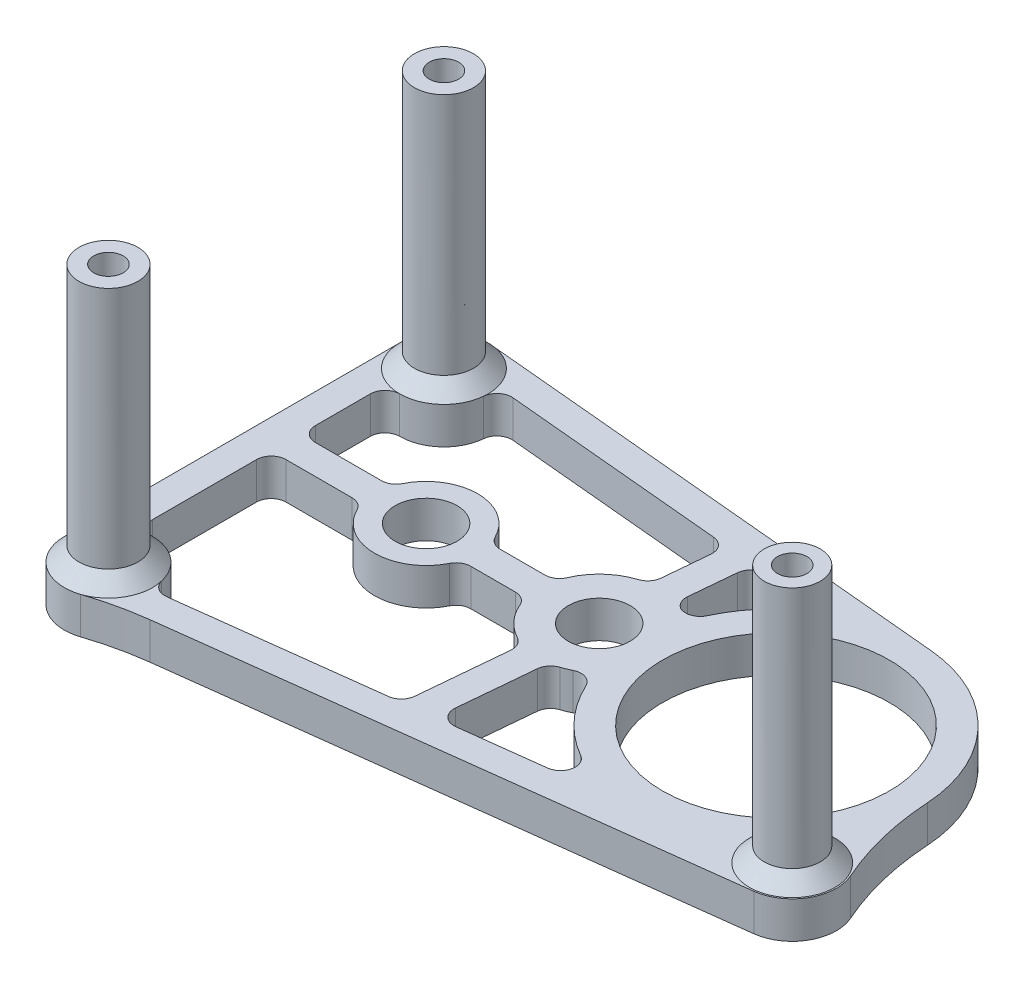
from build123d import *

# Parameters (mm, degrees)
SKETCH2_W           = 97.751871484
SKETCH2_H           = 58.283909604
SKETCH2_R           = 9.779
SKETCH2_R_2         = 2.667
BOSS_EXTRUDE1_DEPTH = 3.175
SKETCH4_R           = 1.27
CUT_EXTRUDE1_DEPTH  = 38.354
BOSS_EXTRUDE2_START = 22.225
SKETCH5_R           = 2.54
SKETCH5_R_2         = 1.27
SKETCH5_R_3         = 2.413
BOSS_EXTRUDE2_DEPTH = 22.225
SKETCH6_W           = 97.751871484
SKETCH6_H           = 58.283909604
CUT_EXTRUDE2_DEPTH  = 25.4
FILLET4_R           = 25.4
CHAMFER1_SIZE       = 1.27
FILLET5_R           = 1.27
FILLET6_R           = 25.4
SKETCH10_R          = 4.445
SKETCH10_R_2        = 2.667
BOSS_EXTRUDE4_DEPTH = 3.175
CUT_EXTRUDE4_DEPTH  = 11.049
FILLET8_R           = 1.27


# Some blends are built 0.0001 mm under size
with BuildPart() as part:
    # Sketch2 → Boss-Extrude1 (new body)
    with BuildSketch(Plane(origin=(0, 0, 0), x_dir=(1, 0, 0), z_dir=(0, 1, 0))):
        with Locations((-16.988515934, 0.541740914)):
            Rectangle(SKETCH2_W, SKETCH2_H)
        with Locations(Location((-4.463227118, 0, 0), (0, 0, 270))):
            Circle(SKETCH2_R, mode=Mode.SUBTRACT)
        with Locations(Location((-19.703227118, 0, 0), (0, 0, 270))):
            Circle(SKETCH2_R_2, mode=Mode.SUBTRACT)
    extrude(amount=BOSS_EXTRUDE1_DEPTH)

    # Sketch4 → Cut-Extrude1 (cut)
    with BuildSketch(Plane(origin=(0, 3.175, 0), x_dir=(1, 0, 0), z_dir=(0, 1, 0))):
        with Locations(Location((6.487419808, -9.550213888, 0), (0, 0, 270))):
            Circle(SKETCH4_R)
        with Locations(Location((-45.435275157, -16.572284597, 0), (0, 0, 270))):
            Circle(SKETCH4_R)
        with Locations(Location((-45.435275157, 12.346724353, 0), (0, 0, 270))):
            Circle(SKETCH4_R)
    extrude(amount=-CUT_EXTRUDE1_DEPTH, mode=Mode.SUBTRACT)

    # Sketch5 → Boss-Extrude2 (add)
    # profile 1 of 3: a face of its own
    with BuildSketch(Plane(origin=(0, 3.175, 0), x_dir=(1, 0, 0), z_dir=(0, 1, 0)).offset(BOSS_EXTRUDE2_START)):
        with Locations(Location((-45.435275157, -16.572284597, 0), (0, 0, 90))):
            Circle(SKETCH5_R)
        with Locations(Location((-45.435275157, -16.572284597, 0), (0, 0, 270))):
            Circle(SKETCH5_R_2, mode=Mode.SUBTRACT)
    # profile 2 of 3: a face of its own
    with BuildSketch(Plane(origin=(0, 3.175, 0), x_dir=(1, 0, 0), z_dir=(0, 1, 0)).offset(BOSS_EXTRUDE2_START)):
        with Locations(Location((6.487419808, -9.550213888, 0), (0, 0, 90))):
            Circle(SKETCH5_R_3)
        with Locations(Location((6.487419808, -9.550213888, 0), (0, 0, 270))):
            Circle(SKETCH5_R_2, mode=Mode.SUBTRACT)
    # profile 3 of 3: a face of its own
    with BuildSketch(Plane(origin=(0, 3.175, 0), x_dir=(1, 0, 0), z_dir=(0, 1, 0)).offset(BOSS_EXTRUDE2_START)):
        with Locations(Location((-45.435275157, 12.346724353, 0), (0, 0, 90))):
            Circle(SKETCH5_R)
        with Locations(Location((-45.435275157, 12.346724353, 0), (0, 0, 270))):
            Circle(SKETCH5_R_2, mode=Mode.SUBTRACT)
    extrude(amount=-BOSS_EXTRUDE2_DEPTH)

    # Sketch6 → Cut-Extrude2 (cut)
    # profile 1 of 5: a face of its own
    with BuildSketch(Plane.XZ):
        with Locations((-16.988515934, -0.541740914)):
            Rectangle(SKETCH6_W, SKETCH6_H)
        with BuildLine():
            ThreePointArc((6.436488339, 5.740554325), (6.365628562, -5.87312912), (-3.329944281, -12.266761227))
            Line((-3.329944281, -12.266761227), (-44.737248056, -16.092236089))
            ThreePointArc((-44.737248056, -16.092236089), (-47.870086931, -15.277217763), (-49.245275157, -12.346724353))
            Line((-49.245275157, -12.346724353), (-49.245275157, 16.572284597))
            ThreePointArc((-49.245275157, 16.572284597), (-47.084422142, 20.006875434), (-43.052931733, 19.545589124))
            Line((-43.052931733, 19.545589124), (6.957251299, 13.331134195))
            ThreePointArc((6.957251299, 13.331134195), (10.28848479, 9.289436202), (6.436488339, 5.740554325))
        make_face(mode=Mode.SUBTRACT)
    # profile 2 of 5: a face of its own
    with BuildSketch(Plane.XZ):
        with BuildLine():
            Line((-22.309779638, 14.408430842), (-41.632671147, 16.809566593))
            ThreePointArc((-41.632671147, 16.809566593), (-43.139721395, 13.531473368), (-46.705275157, 12.980182148))
            Line((-46.705275157, 12.980182148), (-46.705275157, 1.27))
            Line((-46.705275157, 1.27), (-24.752974537, 1.27))
            ThreePointArc((-24.752974537, 1.27), (-23.550764492, 3.508461936), (-21.432391729, 4.911500662))
            Line((-21.432391729, 4.911500662), (-22.309779638, 14.408430842))
        make_face()
    # profile 3 of 5: a face of its own
    with BuildSketch(Plane.XZ):
        with BuildLine():
            ThreePointArc((-18.90316261, 5.145167226), (-17.439844382, 4.689344047), (-16.172627118, 3.827233027))
            ThreePointArc((-16.172627118, 3.827233027), (-12.021521278, 9.727792678), (-5.278151046, 12.292016108))
            Line((-5.278151046, 12.292016108), (-19.729338668, 14.087775465))
            Line((-19.729338668, 14.087775465), (-18.90316261, 5.145167226))
        make_face()
    # profile 4 of 5: a face of its own
    with BuildSketch(Plane.XZ):
        with BuildLine():
            Line((-41.737410786, -13.264274947), (-19.939248877, -11.250419593))
            Line((-19.939248877, -11.250419593), (-20.503291626, -5.145167226))
            ThreePointArc((-20.503291626, -5.145167226), (-23.211689054, -3.847537374), (-24.752974537, -1.27))
            Line((-24.752974537, -1.27), (-46.705275157, -1.27))
            Line((-46.705275157, -1.27), (-46.705275157, -8.754621904))
            ThreePointArc((-46.705275157, -8.754621904), (-42.874440529, -9.525691562), (-41.737410786, -13.264274947))
        make_face()
    # profile 5 of 5: a face of its own
    with BuildSketch(Plane.XZ):
        with BuildLine():
            Line((-17.410019758, -11.016753028), (-11.023764962, -10.426749455))
            ThreePointArc((-11.023764962, -10.426749455), (-14.175902418, -7.577710705), (-16.172627118, -3.827233027))
            ThreePointArc((-16.172627118, -3.827233027), (-17.018047419, -4.461239624), (-17.974062507, -4.911500662))
            Line((-17.974062507, -4.911500662), (-17.410019758, -11.016753028))
        make_face()
    extrude(amount=-CUT_EXTRUDE2_DEPTH, mode=Mode.SUBTRACT)

    # Fillet4
    fillet4_edges = [part.edges().sort_by_distance(p)[0] for p in [
        (6.436488339, 1.5875, 5.740554325),
    ]]
    fillet(fillet4_edges, radius=FILLET4_R)

    # Chamfer1
    chamfer1_edges = [part.edges().sort_by_distance(p)[0] for p in [
        (-45.435275157, 3.175, 19.112284597),
        (6.487419808, 3.175, 11.963213888),
        (-45.435275157, 3.175, -9.806724353),
    ]]
    chamfer(chamfer1_edges, length=CHAMFER1_SIZE - 0.0001)  # a hair under: the kernel refuses the full size

    # Fillet5
    # the kernel refuses this fillet: 1.27 mm, written as the material it adds along each edge
    with BuildSketch(Plane(origin=(-17.974062507, 0, -4.911500662), x_dir=(0.09199471039426901, 0, -0.9957594956913414), z_dir=(0, 1, 0)), Plane(origin=(-24.752974537, 0, -1.27), x_dir=(-1, 0, 0), z_dir=(0, 1, 0))) as fillet5_piece_1:
        with BuildLine():
            CenterArc((0.908434266, -1.27), FILLET5_R, 90, 66.911227563)
            ThreePointArc((-0.259836652, -0.771960784), (-0.114800695, -0.391068882), (0, 0))
            Line((0, 0), (0.908434266, 0))
        make_face()
    extrude(amount=3.175)
    with BuildSketch(Plane(origin=(-16.172627118, 0, -3.827233027), x_dir=(0.3684237494880866, 0, -0.9296579698002592), z_dir=(0, 1, 0))) as fillet5_piece_2:
        with BuildLine():
            CenterArc((1.589945225, 1.267606245), FILLET5_R, 174.6438829, 91.83772784)
            ThreePointArc((0.325490362, 1.38615539), (0.210349349, 0.681899513), (0, 0))
            ThreePointArc((0, 0), (0.756003367, 0.023219427), (1.512006734, 0))
        make_face()
    extrude(amount=3.175)
    with BuildSketch(Plane(origin=(-11.023764962, 0, -10.426749455), x_dir=(-0.7764213228150341, 0, 0.6302141933328324), z_dir=(0, 1, 0))) as fillet5_piece_3:
        with BuildLine():
            CenterArc((3.106991559, -1.260834502), FILLET5_R, 96.887717688, 128.767983471)
            Line((2.219301663, -2.169078218), (0, 0))
            ThreePointArc((0, 0), (1.477344026, -0.08890533), (2.954688051, 0))
        make_face()
    extrude(amount=3.175)
    with BuildSketch(Plane(origin=(-17.410019758, 0, -11.016753028), x_dir=(0.9957594956913395, 0, 0.09199471039428954), z_dir=(0, 1, 0)), Plane(origin=(-46.705275157, 0, -1.27), x_dir=(0, 0, -1), z_dir=(0, 1, 0)), Plane(origin=(-19.939248877, 0, -11.250419593), x_dir=(-0.09199471039428968, 0, 0.9957594956913395), z_dir=(0, 1, 0)), Plane(origin=(-46.705275157, 0, 1.27), x_dir=(1, 0, 0), z_dir=(0, 1, 0))) as fillet5_piece_4:
        with BuildLine():
            CenterArc((FILLET5_R, -FILLET5_R), FILLET5_R, 90, 90)
            Line((0, -FILLET5_R), (0, 0))
            Line((0, 0), (FILLET5_R, 0))
        make_face()
    extrude(amount=3.175)
    with BuildSketch(Plane(origin=(-41.737410786, 0, -13.264274947), x_dir=(0.07388880850314143, 0, 0.9972664859394333), z_dir=(0, 1, 0))) as fillet5_piece_5:
        with BuildLine():
            CenterArc((1.49756055, 1.251850976), FILLET5_R, 170.484249697, 89.817777443)
            Line((0.245035504, 1.461805755), (0, 0))
            ThreePointArc((0, 0), (0.641811664, 0.054447073), (1.283623328, 0))
        make_face()
    extrude(amount=3.175)
    with BuildSketch(Plane(origin=(-46.705275157, 0, -8.754621904), x_dir=(0.9855985596534799, 0, 0.16910197872581528), z_dir=(0, 1, 0))) as fillet5_piece_6:
        with BuildLine():
            CenterArc((1.503316591, -1.251710171), FILLET5_R, 99.735610317, 90)
            Line((0.25160642, -1.466469684), (0, 0))
            ThreePointArc((0, 0), (0.644278539, -0.054869488), (1.288557078, 0))
        make_face()
    extrude(amount=3.175)
    with BuildSketch(Plane(origin=(-20.503291626, 0, -5.145167226), x_dir=(-0.973080394076375, 0, 0.23046593384742647), z_dir=(0, 1, 0)), Plane(origin=(-24.752974537, 0, 1.27), x_dir=(0.31900689110536185, 0, 0.9477523956325786), z_dir=(0, 1, 0)), Plane(origin=(-18.90316261, 0, 5.145167226), x_dir=(0.9730803940763765, 0, -0.23046593384742128), z_dir=(0, 1, 0))) as fillet5_piece_7:
        with BuildLine():
            CenterArc((0.913848751, -1.266109504), FILLET5_R, 94.485895933, 66.911227563)
            Line((-0.289796791, -0.860970752), (0, 0))
            ThreePointArc((0, 0), (0.407258683, -0.015951034), (0.814517365, 0))
        make_face()
    extrude(amount=3.175)
    with BuildSketch(Plane(origin=(-46.705275157, 0, 12.980182148), x_dir=(0, 0, -1), z_dir=(0, 1, 0))) as fillet5_piece_8:
        with BuildLine():
            CenterArc((1.487897552, -1.27), FILLET5_R, 90, 90)
            ThreePointArc((0.217897552, -1.27), (0.163028064, -0.625721461), (0, 0))
            Line((0, 0), (1.487897552, 0))
        make_face()
    extrude(amount=3.175)
    with BuildSketch(Plane(origin=(-41.632671147, 0, 16.809566593), x_dir=(-0.08633378250672864, 0, -0.9962662686240465), z_dir=(0, 1, 0))) as fillet5_piece_9:
        with BuildLine():
            CenterArc((1.317608219, -1.255973552), FILLET5_R, 98.523346596, 83.607406319)
            Line((0.04848632, -1.303192257), (0, 0))
            ThreePointArc((0, 0), (0.564689237, -0.042079345), (1.129378473, 0))
        make_face()
    extrude(amount=3.175)
    with BuildSketch(Plane(origin=(-22.309779638, 0, 14.408430842), x_dir=(-0.9923675347346895, 0, 0.12331535186096959), z_dir=(0, 1, 0))) as fillet5_piece_10:
        with BuildLine():
            CenterArc((FILLET5_R * 0.804568904671, -FILLET5_R), FILLET5_R, 90, 77.638148391)
            Line((-FILLET5_R * 0.172246131175, -FILLET5_R * 0.785915003457), (0, 0))
            Line((0, 0), (FILLET5_R * 0.804568904671, 0))
        make_face()
    extrude(amount=3.175)
    with BuildSketch(Plane(origin=(-21.432391729, 0, 4.911500662), x_dir=(-0.914386500954342, 0, -0.40484234817083437), z_dir=(0, 1, 0))) as fillet5_piece_11:
        with BuildLine():
            CenterArc((0.913848751, 1.266109504), FILLET5_R, 198.602876504, 66.911227563)
            Line((-0.289796791, 0.860970752), (0, 0))
            ThreePointArc((0, 0), (0.407258683, 0.015951034), (0.814517365, 0))
        make_face()
    extrude(amount=3.175)
    with BuildSketch(Plane(origin=(-16.172627118, 0, 3.827233027), x_dir=(0.36842374948808637, 0, 0.9296579698002592), z_dir=(0, 1, 0))) as fillet5_piece_12:
        with BuildLine():
            CenterArc((1.589945225, -1.267606245), FILLET5_R, 93.51838926, 91.83772784)
            ThreePointArc((0.325490362, -1.38615539), (0.210349349, -0.681899513), (0, 0))
            ThreePointArc((0, 0), (0.756003367, -0.023219427), (1.512006734, 0))
        make_face()
    extrude(amount=3.175)
    with BuildSketch(Plane(origin=(-19.729338668, 0, 14.087775465), x_dir=(0.9923675347346897, 0, -0.12331535186096762), z_dir=(0, 1, 0))) as fillet5_piece_13:
        with BuildLine():
            CenterArc((FILLET5_R * 1.24290162619, FILLET5_R), FILLET5_R, 167.638148391, 102.361851609)
            Line((FILLET5_R * 0.266086590346, FILLET5_R * 1.21408499654), (0, 0))
            Line((0, 0), (FILLET5_R * 1.24290162619, 0))
        make_face()
    extrude(amount=3.175)
    with BuildSketch(Plane(origin=(-5.278151046, 0, 12.292016108), x_dir=(-0.9923675347346885, 0, 0.12331535186097764), z_dir=(0, 1, 0))) as fillet5_piece_14:
        with BuildLine():
            CenterArc((5.886574882, -1.27), FILLET5_R, 90, 142.825531736)
            ThreePointArc((5.119184861, -2.281935055), (2.691092308, -0.845966939), (0, 0))
            Line((0, 0), (5.886574882, 0))
        make_face()
    extrude(amount=3.175)

    # Fillet6
    fillet6_edges = [part.edges().sort_by_distance(p)[0] for p in [
        (-43.052931733, 1.5875, 19.545589124),
    ]]
    fillet(fillet6_edges, radius=FILLET6_R)

    # Sketch10 → Boss-Extrude4 (add)
    with BuildSketch(Plane.XZ):
        with Locations((-34.625727118, 0)):
            Circle(SKETCH10_R)
        with Locations((-34.625727118, 0)):
            Circle(SKETCH10_R_2, mode=Mode.SUBTRACT)
    extrude(amount=-BOSS_EXTRUDE4_DEPTH)

    # Sketch11 → Cut-Extrude4 (cut)
    with BuildSketch(Plane.XZ):
        with BuildLine():
            ThreePointArc((-31.958727118, 0), (-32.04042712, 0.655067111), (-32.280521583, 1.27))
            ThreePointArc((-32.280521583, 1.27), (-34.625727118, 2.667), (-36.970932653, 1.27))
            ThreePointArc((-36.970932653, 1.27), (-35.280794229, -2.585299998), (-31.958727118, 0))
        make_face()
    extrude(amount=-CUT_EXTRUDE4_DEPTH, mode=Mode.SUBTRACT)

    # Fillet8
    fillet8_edges = [part.edges().sort_by_distance(p)[0] for p in [
        (-30.366017621, 1.5875, 1.27),
        (-38.885436615, 1.5875, 1.27),
        (-38.885436615, 1.5875, -1.27),
        (-30.366017621, 1.5875, -1.27),
    ]]
    fillet(fillet8_edges, radius=FILLET8_R)


solid = part.part
